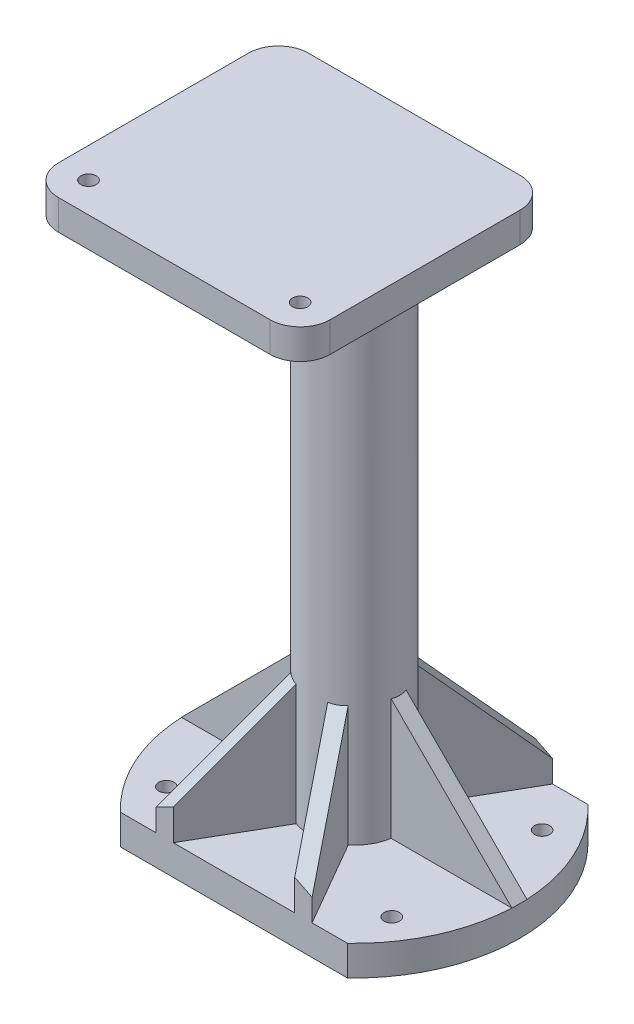
from build123d import *

# Parameters (mm, degrees)
SKETCH1_R                      = 2.55
SKETCH1_R_2                    = 11
BASE_DEPTH                     = 5
SKETCH1_3_R                    = 15
SKETCH1_3_R_2                  = 11
STEM_DEPTH                     = 200
SKETCH4_W                      = 90.4
SKETCH4_H                      = 40
TOP_PLATE_DEPTH                = 10
SKETCH6_W                      = 90.4
SKETCH6_H                      = 10
EXTRA_BACK_DEPTH               = 43.2
RIB1_START                     = -2.5
RIB1_DEPTH                     = 5
CUT_EXTRUDE1_REACH             = 217.059
SKETCH10_R                     = 2.55
CUT_EXTRUDE1_DIRECTION_2_DEPTH = 216.0592709
FILLET1_R                      = 10
FILLET2_R                      = 10
SKETCH11_R                     = 55
NEW_BASE_DEPTH                 = 10
RIB2_START                     = -2.5
RIB2_DEPTH                     = 5
CIRPATTERN7_COUNT              = 6
SKETCH13_R                     = 2.55
CUT_EXTRUDE2_DEPTH             = 10
FILLET3_R                      = 10
SKETCH15_R                     = 11
REMOVE_CENTER_DEPTH            = 208.65172766
BASE_CUT_DEPTH                 = 40
CHAMFER2_SIZE                  = 10
CHAMFER2_SIZE2                 = 4.452286853


with BuildPart() as part:
    # Sketch1 → base (new body)
    with BuildSketch(Plane(origin=(0, 0, 0), x_dir=(1, 0, 0), z_dir=(0, 1, 0))):
        with BuildLine():
            Line((-16, 25.377155081), (-42.833333333, 8.459051694))
            ThreePointArc((-42.833333333, 8.459051694), (-47.5, 0), (-42.833333333, -8.459051694))
            Line((-42.833333333, -8.459051694), (-16, -25.377155081))
            ThreePointArc((-16, -25.377155081), (0, -30), (16, -25.377155081))
            Line((16, -25.377155081), (42.833333333, -8.459051694))
            ThreePointArc((42.833333333, -8.459051694), (47.5, 0), (42.833333333, 8.459051694))
            Line((42.833333333, 8.459051694), (16, 25.377155081))
            ThreePointArc((16, 25.377155081), (0, 30), (-16, 25.377155081))
        make_face()
        with Locations(Location((-37.5, 0, 0), (0, 0, 270))):
            Circle(SKETCH1_R, mode=Mode.SUBTRACT)
        with Locations(Location((37.5, 0, 0), (0, 0, 270))):
            Circle(SKETCH1_R, mode=Mode.SUBTRACT)
        with Locations(Location((0, 0, 0), (0, 0, 270))):
            Circle(SKETCH1_R_2, mode=Mode.SUBTRACT)
    extrude(amount=BASE_DEPTH)

    # Sketch1<3> → stem (add)
    with BuildSketch(Plane(origin=(0, 0, 0), x_dir=(1, 0, 0), z_dir=(0, 1, 0))):
        with Locations(Location((0, 0, 0), (0, 0, 270))):
            Circle(SKETCH1_3_R)
        with Locations(Location((0, 0, 0), (0, 0, 270))):
            Circle(SKETCH1_3_R_2, mode=Mode.SUBTRACT)
    extrude(amount=STEM_DEPTH)

    # Sketch4 → top plate (add)
    with BuildSketch(Plane(origin=(0, 200, 0), x_dir=(1, 0, 0), z_dir=(0, 1, 0))):
        Rectangle(SKETCH4_W, SKETCH4_H)
    extrude(amount=-TOP_PLATE_DEPTH)

    # Sketch6 → extra back (add)
    with BuildSketch(Plane.XY.offset(20)):
        with Locations((0, 195)):
            Rectangle(SKETCH6_W, SKETCH6_H)
    extrude(amount=EXTRA_BACK_DEPTH)

    # Rib1: read off the stored shape, not the designer's step
    # Rib1 outline → Rib1 (add)
    with BuildSketch(Plane(origin=(0, 0, 0), x_dir=(0, 0, -1), z_dir=(1, 0, 0)).offset(RIB1_START)):
        Polygon((-15, 160), (-14.790199458, 160), (-14.790199458, 190), (-55, 190), align=None)
    extrude(amount=RIB1_DEPTH)

    # Sketch10 → Cut-Extrude1 (cut, up to next)
    with BuildSketch(Plane(origin=(0, 200, 0), x_dir=(1, 0, 0), z_dir=(0, 1, 0)), mode=Mode.PRIVATE) as cut_extrude1_sk1:
        with Locations(Location((35.2, -53.2, 0), (0, 0, 90))):
            Circle(SKETCH10_R)
    cut_extrude1_tool1 = extrude(cut_extrude1_sk1.sketch, amount=-CUT_EXTRUDE1_REACH, mode=Mode.PRIVATE) & part.part
    # Sketch10 → Cut-Extrude1 (cut, up to next)
    with BuildSketch(Plane(origin=(0, 200, 0), x_dir=(1, 0, 0), z_dir=(0, 1, 0)), mode=Mode.PRIVATE) as cut_extrude1_sk2:
        with Locations(Location((-35.2, -53.2, 0), (0, 0, 90))):
            Circle(SKETCH10_R)
    cut_extrude1_tool2 = extrude(cut_extrude1_sk2.sketch, amount=-CUT_EXTRUDE1_REACH, mode=Mode.PRIVATE) & part.part
    add(cut_extrude1_tool1.solids().sort_by_distance((35.2, 200, 53.2))[0], mode=Mode.SUBTRACT)
    add(cut_extrude1_tool2.solids().sort_by_distance((-35.2, 200, 53.2))[0], mode=Mode.SUBTRACT)

    # Sketch10 → Cut-Extrude1 direction 2 (cut)
    with BuildSketch(Plane(origin=(0, 200, 0), x_dir=(1, 0, 0), z_dir=(0, 1, 0))):
        with Locations(Location((35.2, -53.2, 0), (0, 0, 90))):
            Circle(SKETCH10_R)
        with Locations(Location((-35.2, -53.2, 0), (0, 0, 90))):
            Circle(SKETCH10_R)
    extrude(amount=CUT_EXTRUDE1_DIRECTION_2_DEPTH, mode=Mode.SUBTRACT)

    # Fillet1
    fillet1_edges = [part.edges().sort_by_distance(p)[0] for p in [
        (-45.2, 195, 63.2),
    ]]
    fillet(fillet1_edges, radius=FILLET1_R)

    # Fillet2
    fillet2_edges = [part.edges().sort_by_distance(p)[0] for p in [
        (45.2, 195, 63.2),
    ]]
    fillet(fillet2_edges, radius=FILLET2_R)

    # Sketch11 → new base (add)
    with BuildSketch(Plane.XZ):
        with Locations(Location((0, 0, 0), (0, 0, 270))):
            Circle(SKETCH11_R)
    extrude(amount=-NEW_BASE_DEPTH)

    # Rib2: read off the stored shape, not the designer's step
    # Rib2 outline → Rib2 (add)
    with BuildSketch(Plane.XY.offset(RIB2_START)):
        Polygon((13, 10), (55, 10), (13, 52), align=None)
    rib2 = extrude(amount=RIB2_DEPTH)

    # CirPattern7: Rib2 ×6 about axis
    cirpattern7_axis = Axis((0, 0, 0), (0, 1, 0))
    for i in range(1, CIRPATTERN7_COUNT):
        add(rib2.rotate(cirpattern7_axis, i * 360 / CIRPATTERN7_COUNT))

    # Sketch13 → Cut-Extrude2 (cut)
    with BuildSketch(Plane.XZ):
        with Locations(Location((-37.5, -25, 0), (0, 0, 270))):
            Circle(SKETCH13_R)
        with Locations(Location((-37.5, 25, 0), (0, 0, 270))):
            Circle(SKETCH13_R)
        with Locations(Location((37.5, 25, 0), (0, 0, 270))):
            Circle(SKETCH13_R)
        with Locations(Location((37.5, -25, 0), (0, 0, 270))):
            Circle(SKETCH13_R)
    extrude(amount=-CUT_EXTRUDE2_DEPTH, mode=Mode.SUBTRACT)

    # Fillet3
    fillet3_edges = [part.edges().sort_by_distance(p)[0] for p in [
        (45.2, 195, -20),
        (-45.2, 195, -20),
    ]]
    fillet(fillet3_edges, radius=FILLET3_R)

    # Sketch15 → remove center (cut, through all)
    with BuildSketch(Plane(origin=(0, 10, 0), x_dir=(1, 0, 0), z_dir=(0, 1, 0))):
        with Locations(Location((0, 0, 0), (0, 0, 270))):
            Circle(SKETCH15_R)
    extrude(amount=-REMOVE_CENTER_DEPTH, mode=Mode.SUBTRACT)

    # Sketch16 → base cut (cut)
    with BuildSketch(Plane.XZ):
        with BuildLine():
            Line((-37.749172176, 40), (37.749172176, 40))
            ThreePointArc((37.749172176, 40), (0, 55), (-37.749172176, 40))
        make_face()
        with BuildLine():
            ThreePointArc((-37.749172176, -40), (0, -55), (37.749172176, -40))
            Line((37.749172176, -40), (-37.749172176, -40))
        make_face()
    extrude(amount=-BASE_CUT_DEPTH, mode=Mode.SUBTRACT)


with BuildPart() as base_cut_kept_piece:
    # of the separate pieces the step leaves, the one the design keeps (base_cut_pieces_kept)
    add(part.part.solids().sort_by_distance((45.2, 190, -10))[0])

    # Chamfer2
    chamfer2_edges = [base_cut_kept_piece.edges().sort_by_distance(p)[0] for p in [
        (0, 190, -15),
    ]]
    chamfer2_side = [base_cut_kept_piece.faces().sort_by_distance(p)[0] for p in [
        (0, 100, -15),
    ]]
    chamfer(chamfer2_edges, length=CHAMFER2_SIZE, length2=CHAMFER2_SIZE2, reference=chamfer2_side[0])


solid = base_cut_kept_piece.part
